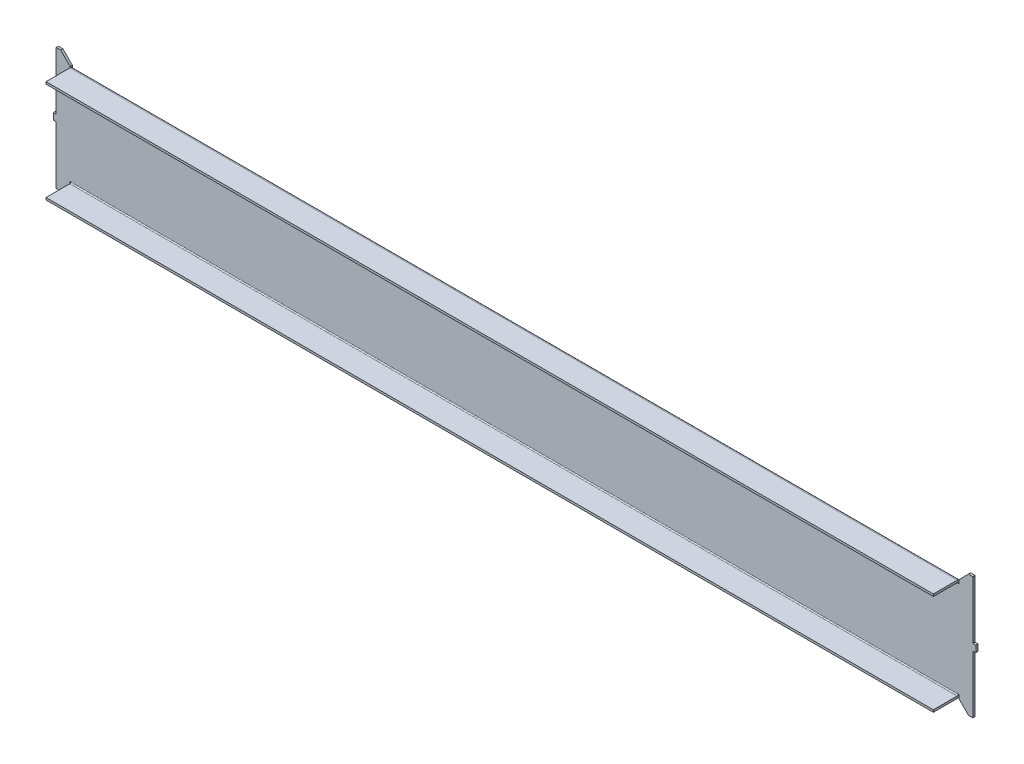
from build123d import *

# Parameters (mm, degrees)
SKETCH_1_W                         = 626
SKETCH_1_H                         = 70
SM_BASE_FLANGE_1_DEPTH             = 1.5
SM_EDGE_FLANGE_1_STRIP_W           = 7.4732
SM_EDGE_FLANGE_1_STRIP_H           = 1.5
SM_EDGE_FLANGE_1_STRIP_CUT_DEPTH   = 626
SM_EDGE_FLANGE_1_STRIP_2_W         = 7.4732
SM_EDGE_FLANGE_1_STRIP_2_H         = 1.5
SM_EDGE_FLANGE_1_STRIP_CUT_2_DEPTH = 626
SM_EDGE_FLANGE_1_DEPTH             = 626
SM_EDGE_FLANGE_1_BEND_DEPTH        = 626
SKETCH_8_W                         = 2
SKETCH_8_H                         = 4.5
SM_BASE_FLANGE_1_2_DEPTH           = 1.5
CUT_EXTRUDE_1_REACH                = 319.478
SKETCH_11_W                        = 10
SKETCH_11_H                        = 2.2366
SM_BASE_FLANGE_2_DEPTH             = 1.5
SKETCH_13_R                        = 3.25
CUT_EXTRUDE_2_DEPTH                = 1.5


# Sheet-metal steps are written as plain solids
with BuildPart() as part:
    # Sketch 1 → Sm Base Flange 1 (new body)
    with BuildSketch(Plane.XY):
        Rectangle(SKETCH_1_W, SKETCH_1_H)
    extrude(amount=-SM_BASE_FLANGE_1_DEPTH)

    # Ребро-кромка1 strip (across the edge) → Ребро-кромка1 strip cut (cut)
    with BuildSketch(Plane(origin=(313, 35, 0), x_dir=(0, -1, 0), z_dir=(-1, 0, 0))):
        with Locations((-1.5, -0.75)):
            Rectangle(SM_EDGE_FLANGE_1_STRIP_W, SM_EDGE_FLANGE_1_STRIP_H)
    extrude(amount=SM_EDGE_FLANGE_1_STRIP_CUT_DEPTH, mode=Mode.SUBTRACT)

    # Ребро-кромка1 strip 2 (across the edge) → Ребро-кромка1 strip cut 2 (cut)
    with BuildSketch(Plane(origin=(-313, -35, 0), x_dir=(0, 1, 0), z_dir=(1, 0, 0))):
        with Locations((-1.5, -0.75)):
            Rectangle(SM_EDGE_FLANGE_1_STRIP_2_W, SM_EDGE_FLANGE_1_STRIP_2_H)
    extrude(amount=SM_EDGE_FLANGE_1_STRIP_CUT_2_DEPTH, mode=Mode.SUBTRACT)

    # Ребро-кромка1 section (across the edge) → Ребро-кромка1 (add)
    with BuildSketch(Plane(origin=(313, 35, 0), x_dir=(0, -1, 0), z_dir=(-1, 0, 0))):
        with BuildLine():
            Line((0, 0.7366), (0, 17))
            Line((0, 17), (1.5, 17))
            Line((1.5, 17), (1.5, 0.7366))
            ThreePointArc((1.5, 0.7366), (1.715745145, 0.215745145), (2.2366, 0))
            Line((2.2366, 0), (2.2366, -1.5))
            ThreePointArc((2.2366, -1.5), (0.655084973, -0.844915027), (0, 0.7366))
        make_face()
    extrude(amount=SM_EDGE_FLANGE_1_DEPTH)

    # Ребро-кромка1 section 2 (across the edge) → Ребро-кромка1 bend (add)
    with BuildSketch(Plane(origin=(-313, -35, 0), x_dir=(0, 1, 0), z_dir=(1, 0, 0))):
        with BuildLine():
            Line((0, 0.7366), (0, 17))
            Line((0, 17), (1.5, 17))
            Line((1.5, 17), (1.5, 0.7366))
            ThreePointArc((1.5, 0.7366), (1.715745145, 0.215745145), (2.2366, 0))
            Line((2.2366, 0), (2.2366, -1.5))
            ThreePointArc((2.2366, -1.5), (0.655084973, -0.844915027), (0, 0.7366))
        make_face()
    extrude(amount=SM_EDGE_FLANGE_1_BEND_DEPTH)

    # Эскиз8 → Sm Base Flange 1 2 (add)
    with BuildSketch(Plane.XY):
        with Locations((-314, 0)):
            Rectangle(SKETCH_8_W, SKETCH_8_H)
        with Locations((314, 0)):
            Rectangle(SKETCH_8_W, SKETCH_8_H)
    extrude(amount=-SM_BASE_FLANGE_1_2_DEPTH)

    # Эскиз11 → Вырез-Вытянуть1 (cut, up to next)
    with BuildSketch(Plane.XY.offset(17), mode=Mode.PRIVATE) as cut_extrude_1_sk1:
        with Locations((-308, 33.8817)):
            Rectangle(SKETCH_11_W, SKETCH_11_H)
    cut_extrude_1_tool1 = extrude(cut_extrude_1_sk1.sketch, amount=-CUT_EXTRUDE_1_REACH, mode=Mode.PRIVATE) & part.part
    # Эскиз11 → Вырез-Вытянуть1 (cut, up to next)
    with BuildSketch(Plane.XY.offset(17), mode=Mode.PRIVATE) as cut_extrude_1_sk2:
        with Locations((-308, -33.8817)):
            Rectangle(SKETCH_11_W, SKETCH_11_H)
    cut_extrude_1_tool2 = extrude(cut_extrude_1_sk2.sketch, amount=-CUT_EXTRUDE_1_REACH, mode=Mode.PRIVATE) & part.part
    # Эскиз11 → Вырез-Вытянуть1 (cut, up to next)
    with BuildSketch(Plane.XY.offset(17), mode=Mode.PRIVATE) as cut_extrude_1_sk3:
        with Locations((308, -33.8817)):
            Rectangle(SKETCH_11_W, SKETCH_11_H)
    cut_extrude_1_tool3 = extrude(cut_extrude_1_sk3.sketch, amount=-CUT_EXTRUDE_1_REACH, mode=Mode.PRIVATE) & part.part
    # Эскиз11 → Вырез-Вытянуть1 (cut, up to next)
    with BuildSketch(Plane.XY.offset(17), mode=Mode.PRIVATE) as cut_extrude_1_sk4:
        with Locations((308, 33.8817)):
            Rectangle(SKETCH_11_W, SKETCH_11_H)
    cut_extrude_1_tool4 = extrude(cut_extrude_1_sk4.sketch, amount=-CUT_EXTRUDE_1_REACH, mode=Mode.PRIVATE) & part.part
    add(cut_extrude_1_tool1.solids().sort_by_distance((-308, 33.8817, 17))[0], mode=Mode.SUBTRACT)
    add(cut_extrude_1_tool2.solids().sort_by_distance((-308, -33.8817, 17))[0], mode=Mode.SUBTRACT)
    add(cut_extrude_1_tool3.solids().sort_by_distance((308, -33.8817, 17))[0], mode=Mode.SUBTRACT)
    add(cut_extrude_1_tool4.solids().sort_by_distance((308, 33.8817, 17))[0], mode=Mode.SUBTRACT)

    # Эскиз12 → Выступ2 (add)
    with BuildSketch(Plane.XY):
        Polygon((-313, 32.7634), (-313, 41.7634), (-310, 41.7634), (-303.5, 35.2634), (-303.5, 32.7634), align=None)
        Polygon((-303.5, -32.7634), (-313, -32.7634), (-313, -41.7634), (-310, -41.7634), (-303.5, -35.2634), align=None)
        Polygon((313, -32.7634), (313, -41.7634), (310, -41.7634), (303.5, -35.2634), (303.5, -32.7634), align=None)
        Polygon((303.5, 32.7634), (313, 32.7634), (313, 41.7634), (310, 41.7634), (303.5, 35.2634), align=None)
    extrude(amount=-SM_BASE_FLANGE_2_DEPTH)

    # Эскиз13 → Вырез-Вытянуть2 (cut)
    with BuildSketch(Plane.XY):
        with Locations((-270, 22)):
            Circle(SKETCH_13_R)
        with Locations((-222, 22)):
            Circle(SKETCH_13_R)
        with Locations(Location((222, 22, 0), (0, 0, 180))):
            Circle(SKETCH_13_R)
        with Locations(Location((270, 22, 0), (0, 0, 180))):
            Circle(SKETCH_13_R)
    extrude(amount=-CUT_EXTRUDE_2_DEPTH, mode=Mode.SUBTRACT)


solid = part.part
